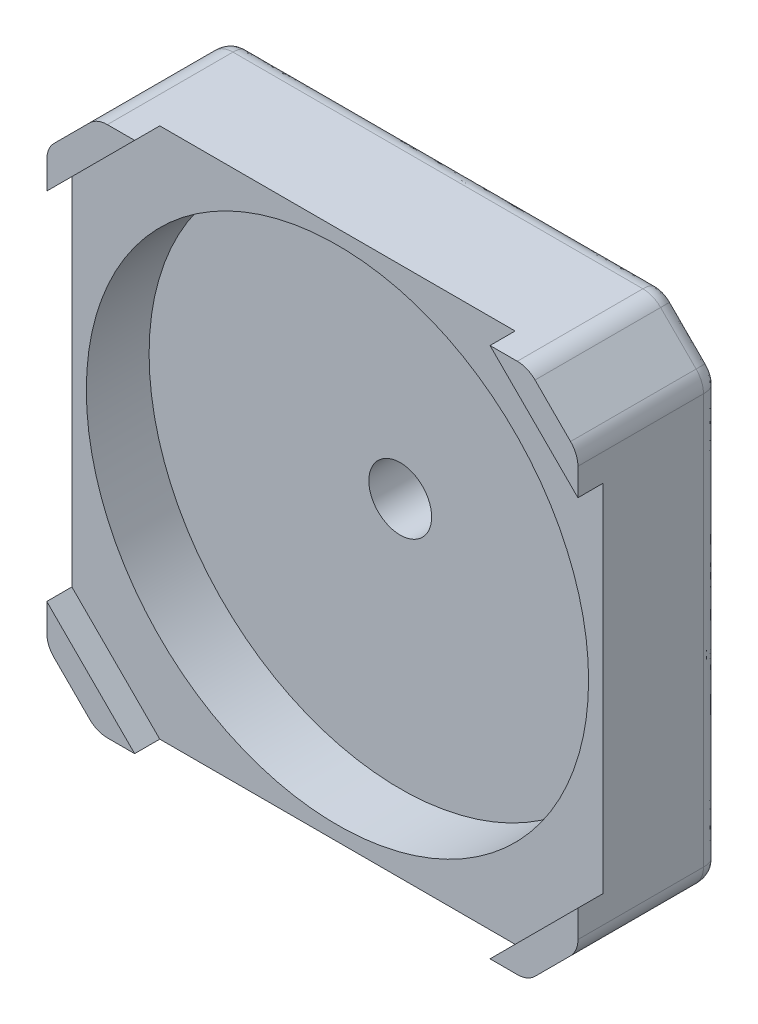
from build123d import *

# Parameters (mm, degrees)
SZKIC1_W                    = 42.3
SZKIC1_H                    = 42.3
DODANIE_WYCI_GNI_CIE1_DEPTH = 9
SFAZOWANIE1_SIZE            = 4
ZAOKR_GLENIE1_R             = 2
ZAOKR_GLENIE2_SIZE          = 1
ZAOKR_GLENIE2_SIZE_2        = 0.5
SZKIC2_R                    = 11
DODANIE_WYCI_GNI_CIE2_DEPTH = 2
SZKIC4_R                    = 3.75
WYTNIJ_WYCI_GNI_CIE1_DEPTH  = 2
WYTNIJ_WYCI_GNI_CIE2_REACH  = 33.235
SZKIC5_R                    = 2.5
DODANIE_WYCI_GNI_CIE3_START = 2
DODANIE_WYCI_GNI_CIE3_DEPTH = 2
SZYK_KO_OWY1_COUNT          = 4
OTW_R_GWINTOWANY_M31_D      = 2.5
OTW_R_GWINTOWANY_M31_DEPTH  = 4.5
OTW_R_GWINTOWANY_M31_TIP    = 0.751075774
SZKIC10_R                   = 20
WYTNIJ_WYCI_GNI_CIE3_DEPTH  = 5


with BuildPart() as part:
    # Szkic1 → Dodanie-wyciągnięcie1 (new body)
    with BuildSketch(Plane.XY):
        Rectangle(SZKIC1_W, SZKIC1_H)
    extrude(amount=DODANIE_WYCI_GNI_CIE1_DEPTH)

    # Sfazowanie1
    sfazowanie1_edges = [part.edges().sort_by_distance(p)[0] for p in [
        (21.15, -21.15, 4.5),
        (-21.15, -21.15, 4.5),
        (-21.15, 21.15, 4.5),
        (21.15, 21.15, 4.5),
    ]]
    chamfer(sfazowanie1_edges, length=SFAZOWANIE1_SIZE)

    # Zaokrąglenie1
    zaokr_glenie1_edges = [part.edges().sort_by_distance(p)[0] for p in [
        (17.15, -21.15, 4.5),
        (-17.15, -21.15, 4.5),
        (-21.15, 17.15, 4.5),
        (-21.15, -17.15, 4.5),
        (21.15, 17.15, 4.5),
        (21.15, -17.15, 4.5),
        (17.15, 21.15, 4.5),
        (-17.15, 21.15, 4.5),
    ]]
    fillet(zaokr_glenie1_edges, radius=ZAOKR_GLENIE1_R)

    # Zaokrąglenie2
    # an asymmetric fillet: 1, 0.5 mm, written as the material it takes off along each edge
    with BuildSketch(Plane(origin=(-16.321572875, -21.15, 0), x_dir=(0, 0, 1), z_dir=(1, 0, 0))) as zaokr_glenie2_piece_1:
        with BuildLine():
            Bezier((ZAOKR_GLENIE2_SIZE, 0), (0, 0), (0, -ZAOKR_GLENIE2_SIZE_2), weights=[1, 0.707106781, 1])
            Line((0, -ZAOKR_GLENIE2_SIZE_2), (0, 0))
            Line((0, 0), (ZAOKR_GLENIE2_SIZE, 0))
        make_face()
    extrude(amount=32.643145751, mode=Mode.SUBTRACT)
    with BuildSketch(Plane(origin=(16.321572875, -19.15, 0), x_dir=(0, -1, 0), z_dir=(-1, 0, 0))) as zaokr_glenie2_piece_2:
        with BuildLine():
            Bezier((2 - ZAOKR_GLENIE2_SIZE_2, 0), (2, 0), (2, ZAOKR_GLENIE2_SIZE), weights=[1, 0.707106781, 1])
            Line((2, ZAOKR_GLENIE2_SIZE), (2, 0))
            Line((2, 0), (2 - ZAOKR_GLENIE2_SIZE_2, 0))
        make_face()
    revolve(axis=Axis((16.321572875, -19.15, 0), (0, 0, 1)), revolution_arc=45, mode=Mode.SUBTRACT)
    with BuildSketch(Plane(origin=(-16.321572875, -19.15, 0), x_dir=(0, -1, 0), z_dir=(1, 0, 0))) as zaokr_glenie2_piece_3:
        with BuildLine():
            Bezier((2 - ZAOKR_GLENIE2_SIZE_2, 0), (2, 0), (2, -ZAOKR_GLENIE2_SIZE), weights=[1, 0.707106781, 1])
            Line((2, -ZAOKR_GLENIE2_SIZE), (2, 0))
            Line((2, 0), (2 - ZAOKR_GLENIE2_SIZE_2, 0))
        make_face()
    revolve(axis=Axis((-16.321572875, -19.15, 0), (0, 0, -1)), revolution_arc=45, mode=Mode.SUBTRACT)
    with BuildSketch(Plane(origin=(17.735786438, -20.564213562, 0), x_dir=(-0.7071067811865476, 0.7071067811865476, 0), z_dir=(0.7071067811865476, 0.7071067811865476, 0)), Plane(origin=(20.564213562, 17.735786438, 0), x_dir=(-0.7071067811865476, -0.7071067811865476, 0), z_dir=(-0.7071067811865476, 0.7071067811865476, 0)), Plane(origin=(-17.735786438, 20.564213562, 0), x_dir=(0.7071067811865476, -0.7071067811865476, 0), z_dir=(-0.7071067811865476, -0.7071067811865476, 0))) as zaokr_glenie2_piece_4:
        with BuildLine():
            Bezier((ZAOKR_GLENIE2_SIZE_2, 0), (0, 0), (0, ZAOKR_GLENIE2_SIZE), weights=[1, 0.707106781, 1])
            Line((0, ZAOKR_GLENIE2_SIZE), (0, 0))
            Line((0, 0), (ZAOKR_GLENIE2_SIZE_2, 0))
        make_face()
    extrude(amount=4, mode=Mode.SUBTRACT)
    with BuildSketch(Plane(origin=(-17.735786438, -20.564213562, 0), x_dir=(0.7071067811865476, 0.7071067811865476, 0), z_dir=(-0.7071067811865476, 0.7071067811865476, 0))) as zaokr_glenie2_piece_5:
        with BuildLine():
            Bezier((ZAOKR_GLENIE2_SIZE_2, 0), (0, 0), (0, -ZAOKR_GLENIE2_SIZE), weights=[1, 0.707106781, 1])
            Line((0, -ZAOKR_GLENIE2_SIZE), (0, 0))
            Line((0, 0), (ZAOKR_GLENIE2_SIZE_2, 0))
        make_face()
    extrude(amount=4, mode=Mode.SUBTRACT)
    with BuildSketch(Plane(origin=(19.15, -16.321572875, 0), x_dir=(0.7071067811865476, -0.7071067811865476, 0), z_dir=(-0.7071067811865476, -0.7071067811865476, 0))) as zaokr_glenie2_piece_6:
        with BuildLine():
            Bezier((2 - ZAOKR_GLENIE2_SIZE_2, 0), (2, 0), (2, ZAOKR_GLENIE2_SIZE), weights=[1, 0.707106781, 1])
            Line((2, ZAOKR_GLENIE2_SIZE), (2, 0))
            Line((2, 0), (2 - ZAOKR_GLENIE2_SIZE_2, 0))
        make_face()
    revolve(axis=Axis((19.15, -16.321572875, 0), (0, 0, 1)), revolution_arc=45, mode=Mode.SUBTRACT)
    with BuildSketch(Plane(origin=(-19.15, -16.321572875, 0), x_dir=(-0.7071067811865476, -0.7071067811865476, 0), z_dir=(0.7071067811865476, -0.7071067811865476, 0))) as zaokr_glenie2_piece_7:
        with BuildLine():
            Bezier((2 - ZAOKR_GLENIE2_SIZE_2, 0), (2, 0), (2, -ZAOKR_GLENIE2_SIZE), weights=[1, 0.707106781, 1])
            Line((2, -ZAOKR_GLENIE2_SIZE), (2, 0))
            Line((2, 0), (2 - ZAOKR_GLENIE2_SIZE_2, 0))
        make_face()
    revolve(axis=Axis((-19.15, -16.321572875, 0), (0, 0, -1)), revolution_arc=45, mode=Mode.SUBTRACT)
    with BuildSketch(Plane(origin=(21.15, -16.321572875, 0), x_dir=(-1, 0, 0), z_dir=(0, 1, 0)), Plane(origin=(-21.15, 16.321572875, 0), x_dir=(1, 0, 0), z_dir=(0, -1, 0)), Plane(origin=(16.321572875, 21.15, 0), x_dir=(0, -1, 0), z_dir=(-1, 0, 0))) as zaokr_glenie2_piece_8:
        with BuildLine():
            Bezier((ZAOKR_GLENIE2_SIZE_2, 0), (0, 0), (0, ZAOKR_GLENIE2_SIZE), weights=[1, 0.707106781, 1])
            Line((0, ZAOKR_GLENIE2_SIZE), (0, 0))
            Line((0, 0), (ZAOKR_GLENIE2_SIZE_2, 0))
        make_face()
    extrude(amount=32.643145751, mode=Mode.SUBTRACT)
    with BuildSketch(Plane(origin=(19.15, 16.321572875, 0), x_dir=(1, 0, 0), z_dir=(0, -1, 0))) as zaokr_glenie2_piece_9:
        with BuildLine():
            Bezier((2 - ZAOKR_GLENIE2_SIZE_2, 0), (2, 0), (2, ZAOKR_GLENIE2_SIZE), weights=[1, 0.707106781, 1])
            Line((2, ZAOKR_GLENIE2_SIZE), (2, 0))
            Line((2, 0), (2 - ZAOKR_GLENIE2_SIZE_2, 0))
        make_face()
    revolve(axis=Axis((19.15, 16.321572875, 0), (0, 0, 1)), revolution_arc=45, mode=Mode.SUBTRACT)
    with BuildSketch(Plane(origin=(-19.15, 16.321572875, 0), x_dir=(-1, 0, 0), z_dir=(0, -1, 0))) as zaokr_glenie2_piece_10:
        with BuildLine():
            Bezier((2 - ZAOKR_GLENIE2_SIZE_2, 0), (2, 0), (2, -ZAOKR_GLENIE2_SIZE), weights=[1, 0.707106781, 1])
            Line((2, -ZAOKR_GLENIE2_SIZE), (2, 0))
            Line((2, 0), (2 - ZAOKR_GLENIE2_SIZE_2, 0))
        make_face()
    revolve(axis=Axis((-19.15, 16.321572875, 0), (0, 0, -1)), revolution_arc=45, mode=Mode.SUBTRACT)
    with BuildSketch(Plane(origin=(16.321572875, 19.15, 0), x_dir=(0.7071067811865476, 0.7071067811865476, 0), z_dir=(0.7071067811865476, -0.7071067811865476, 0))) as zaokr_glenie2_piece_11:
        with BuildLine():
            Bezier((2 - ZAOKR_GLENIE2_SIZE_2, 0), (2, 0), (2, ZAOKR_GLENIE2_SIZE), weights=[1, 0.707106781, 1])
            Line((2, ZAOKR_GLENIE2_SIZE), (2, 0))
            Line((2, 0), (2 - ZAOKR_GLENIE2_SIZE_2, 0))
        make_face()
    revolve(axis=Axis((16.321572875, 19.15, 0), (0, 0, 1)), revolution_arc=45, mode=Mode.SUBTRACT)
    with BuildSketch(Plane(origin=(-16.321572875, 19.15, 0), x_dir=(-0.7071067811865476, 0.7071067811865476, 0), z_dir=(-0.7071067811865476, -0.7071067811865476, 0))) as zaokr_glenie2_piece_12:
        with BuildLine():
            Bezier((2 - ZAOKR_GLENIE2_SIZE_2, 0), (2, 0), (2, -ZAOKR_GLENIE2_SIZE), weights=[1, 0.707106781, 1])
            Line((2, -ZAOKR_GLENIE2_SIZE), (2, 0))
            Line((2, 0), (2 - ZAOKR_GLENIE2_SIZE_2, 0))
        make_face()
    revolve(axis=Axis((-16.321572875, 19.15, 0), (0, 0, -1)), revolution_arc=45, mode=Mode.SUBTRACT)

    # Szkic2 → Dodanie-wyciągnięcie2 (add)
    with BuildSketch(Plane(origin=(0, 0, 0), x_dir=(-1, 0, 0), z_dir=(0, 0, -1))):
        Circle(SZKIC2_R)
    extrude(amount=DODANIE_WYCI_GNI_CIE2_DEPTH)

    # Szkic3 → Wycięcie-obrót1 (revolve, cut)
    with BuildSketch(Plane(origin=(0, 0, 0), x_dir=(1, 0, 0), z_dir=(0, 1, 0))):
        Polygon((-11, 0), (-11.2, -0.15), (-11.3, -0.15), (-11.5, 0), align=None)
    revolve(axis=Axis((0, 0, -2.55000125), (0, 0, 1)), mode=Mode.SUBTRACT)

    # Szkic4 → Wytnij-wyciągnięcie1 (cut)
    with BuildSketch(Plane(origin=(0, 0, -2), x_dir=(-1, 0, 0), z_dir=(0, 0, -1))):
        Circle(SZKIC4_R)
    extrude(amount=-WYTNIJ_WYCI_GNI_CIE1_DEPTH, mode=Mode.SUBTRACT)

    # Szkic5 → Wytnij-wyciągnięcie2 (cut, up to next)
    with BuildSketch(Plane(origin=(0, 0, 0), x_dir=(-1, 0, 0), z_dir=(0, 0, -1)), mode=Mode.PRIVATE) as wytnij_wyci_gni_cie2_sk1:
        Circle(SZKIC5_R)
    wytnij_wyci_gni_cie2_tool1 = extrude(wytnij_wyci_gni_cie2_sk1.sketch, amount=-WYTNIJ_WYCI_GNI_CIE2_REACH, mode=Mode.PRIVATE) & part.part
    add(wytnij_wyci_gni_cie2_tool1.solids().sort_by_distance((0, 0, 0))[0], mode=Mode.SUBTRACT)

    # Szkic6 → Dodanie-wyciągnięcie3 (add)
    with BuildSketch(Plane.XY.offset(9).offset(DODANIE_WYCI_GNI_CIE3_START)):
        with BuildLine():
            Line((14.15, 21.15), (21.15, 14.15))
            Line((21.15, 14.15), (21.15, 16.321572875))
            ThreePointArc((21.15, 16.321572875), (20.997759065, 17.08693974), (20.564213562, 17.735786438))
            Line((20.564213562, 17.735786438), (17.735786438, 20.564213562))
            ThreePointArc((17.735786438, 20.564213562), (17.08693974, 20.997759065), (16.321572875, 21.15))
            Line((16.321572875, 21.15), (14.15, 21.15))
        make_face()
    dodanie_wyci_gni_cie3 = extrude(amount=-DODANIE_WYCI_GNI_CIE3_DEPTH)

    # Szyk kołowy1: Dodanie-wyciągnięcie3 ×4 about axis
    szyk_ko_owy1_axis = Axis((0, 0, 0), (0, 0, 1))
    for i in range(1, SZYK_KO_OWY1_COUNT):
        add(dodanie_wyci_gni_cie3.rotate(szyk_ko_owy1_axis, i * 360 / SZYK_KO_OWY1_COUNT))

    # Otwór gwintowany M31
    with Locations(Plane(origin=(0, 0, 0), x_dir=(-1, 0, 0), z_dir=(0, 0, -1))):
        with Locations((-15.5, 15.5), (15.5, 15.5), (15.5, -15.5), (-15.5, -15.5)):
            Hole(OTW_R_GWINTOWANY_M31_D / 2, depth=OTW_R_GWINTOWANY_M31_DEPTH)
            with Locations((0, 0, -(OTW_R_GWINTOWANY_M31_DEPTH + OTW_R_GWINTOWANY_M31_TIP / 2))):  # 118° drill point
                Cone(0, OTW_R_GWINTOWANY_M31_D / 2, OTW_R_GWINTOWANY_M31_TIP, mode=Mode.SUBTRACT)

    # Szkic10 → Wytnij-wyciągnięcie3 (cut)
    with BuildSketch(Plane.XY.offset(9)):
        Circle(SZKIC10_R)
    extrude(amount=-WYTNIJ_WYCI_GNI_CIE3_DEPTH, mode=Mode.SUBTRACT)


solid = part.part
